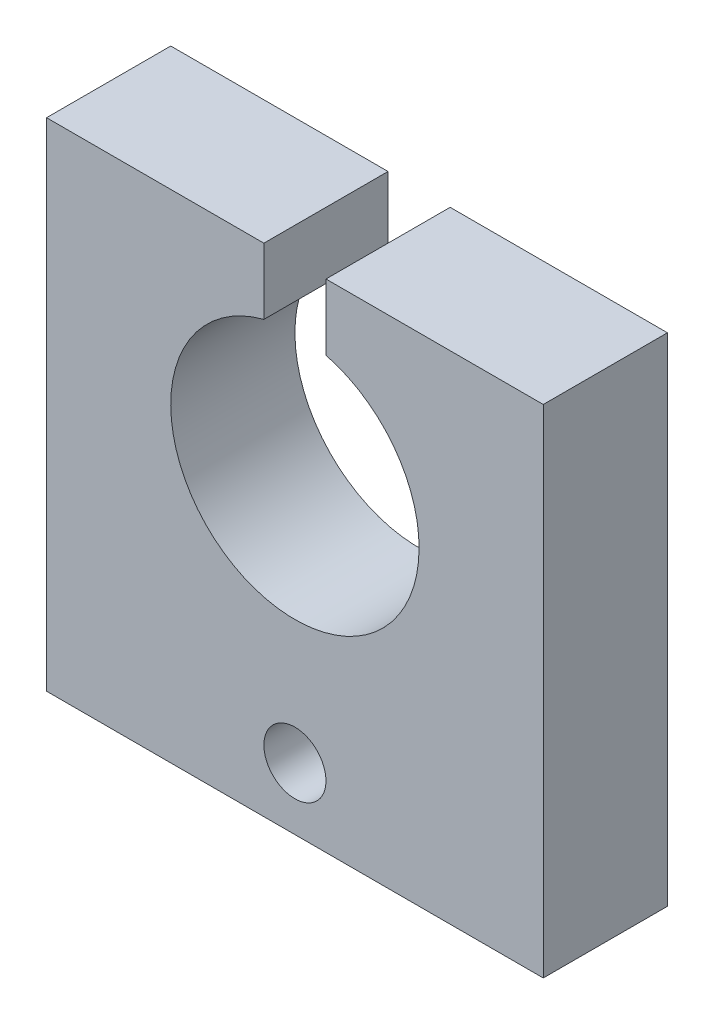
from build123d import *

# Parameters (mm, degrees)
SKETCH1_W           = 25.4
SKETCH1_H           = 25.4
BOSS_EXTRUDE1_DEPTH = 6.35
CUT_EXTRUDE1_DEPTH  = 20.05
SKETCH3_R           = 1.5875
CUT_EXTRUDE2_DEPTH  = 20.05


with BuildPart() as part:
    # Sketch1 → Boss-Extrude1 (new body)
    with BuildSketch(Plane.XY):
        Rectangle(SKETCH1_W, SKETCH1_H)
    extrude(amount=BOSS_EXTRUDE1_DEPTH)

    # Sketch2 → Cut-Extrude1 (cut, through all)
    with BuildSketch(Plane.XY.offset(6.35)):
        with BuildLine():
            Line((1.5875, 9.323361062), (1.5875, 12.7))
            Line((1.5875, 12.7), (-1.5875, 12.7))
            Line((-1.5875, 12.7), (-1.5875, 9.323361062))
            ThreePointArc((-1.5875, 9.323361062), (0, -3.175), (1.5875, 9.323361062))
        make_face()
    extrude(amount=-CUT_EXTRUDE1_DEPTH, mode=Mode.SUBTRACT)

    # Sketch3 → Cut-Extrude2 (cut, through all)
    with BuildSketch(Plane.XY.offset(6.35)):
        with Locations((0, -9.525)):
            Circle(SKETCH3_R)
    extrude(amount=-CUT_EXTRUDE2_DEPTH, mode=Mode.SUBTRACT)


solid = part.part
